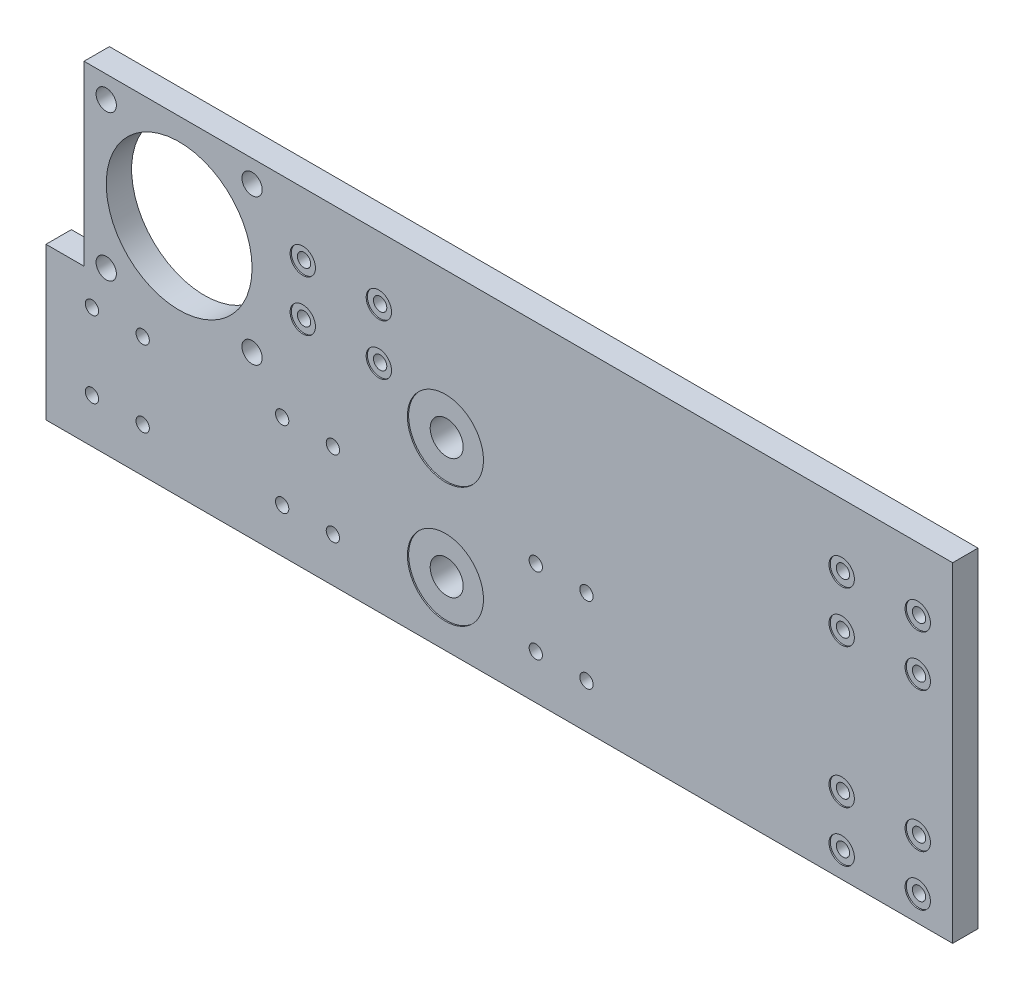
from build123d import *

# Parameters (mm, degrees)
SKETCH_1_R          = 11.5
SKETCH_1_R_2        = 1.6
SKETCH_1_R_3        = 1.05
SKETCH_1_R_4        = 2.6
EXTRUDE_1_DEPTH     = 4
SKETCH_2_R          = 2
SKETCH_2_R_2        = 6
CUT_EXTRUDE_1_DEPTH = 0.2
SKETCH_5_R          = 2
CUT_EXTRUDE_2_DEPTH = 2


with BuildPart() as part:
    # 草图1 → 凸台-拉伸1 (new body)
    with BuildSketch(Plane.XY):
        Polygon((0, 0), (135, 0), (135, -52), (0, -52), (-8, -52), (-8, -28), (-2, -28), (-2, 0), align=None)
        with Locations((13, -15)):
            Circle(SKETCH_1_R, mode=Mode.SUBTRACT)
        with Locations((1.5, -3.5)):
            Circle(SKETCH_1_R_2, mode=Mode.SUBTRACT)
        with Locations((24.5, -3.5)):
            Circle(SKETCH_1_R_2, mode=Mode.SUBTRACT)
        with Locations((1.5, -26.5)):
            Circle(SKETCH_1_R_2, mode=Mode.SUBTRACT)
        with Locations((24.5, -26.5)):
            Circle(SKETCH_1_R_2, mode=Mode.SUBTRACT)
        with Locations((32.5, -10)):
            Circle(SKETCH_1_R_3, mode=Mode.SUBTRACT)
        with Locations((44.5, -10)):
            Circle(SKETCH_1_R_3, mode=Mode.SUBTRACT)
        with Locations((32.5, -18)):
            Circle(SKETCH_1_R_3, mode=Mode.SUBTRACT)
        with Locations((44.5, -18)):
            Circle(SKETCH_1_R_3, mode=Mode.SUBTRACT)
        with Locations((117.5, -10)):
            Circle(SKETCH_1_R_3, mode=Mode.SUBTRACT)
        with Locations((129.5, -10)):
            Circle(SKETCH_1_R_3, mode=Mode.SUBTRACT)
        with Locations((117.5, -18)):
            Circle(SKETCH_1_R_3, mode=Mode.SUBTRACT)
        with Locations((129.5, -18)):
            Circle(SKETCH_1_R_3, mode=Mode.SUBTRACT)
        with Locations((-0.75, -33)):
            Circle(SKETCH_1_R_3, mode=Mode.SUBTRACT)
        with Locations((7.25, -33)):
            Circle(SKETCH_1_R_3, mode=Mode.SUBTRACT)
        with Locations((-0.75, -45)):
            Circle(SKETCH_1_R_3, mode=Mode.SUBTRACT)
        with Locations((7.25, -45)):
            Circle(SKETCH_1_R_3, mode=Mode.SUBTRACT)
        with Locations((29.25, -33)):
            Circle(SKETCH_1_R_3, mode=Mode.SUBTRACT)
        with Locations((37.25, -33)):
            Circle(SKETCH_1_R_3, mode=Mode.SUBTRACT)
        with Locations((37.25, -45)):
            Circle(SKETCH_1_R_3, mode=Mode.SUBTRACT)
        with Locations((29.25, -45)):
            Circle(SKETCH_1_R_3, mode=Mode.SUBTRACT)
        with Locations((117.5, -40)):
            Circle(SKETCH_1_R_3, mode=Mode.SUBTRACT)
        with Locations((129.5, -40)):
            Circle(SKETCH_1_R_3, mode=Mode.SUBTRACT)
        with Locations((117.5, -48)):
            Circle(SKETCH_1_R_3, mode=Mode.SUBTRACT)
        with Locations((129.5, -48)):
            Circle(SKETCH_1_R_3, mode=Mode.SUBTRACT)
        with Locations((55, -23)):
            Circle(SKETCH_1_R_4, mode=Mode.SUBTRACT)
        with Locations((55, -42)):
            Circle(SKETCH_1_R_4, mode=Mode.SUBTRACT)
        with Locations((77.25, -33)):
            Circle(SKETCH_1_R_3, mode=Mode.SUBTRACT)
        with Locations((77.25, -45)):
            Circle(SKETCH_1_R_3, mode=Mode.SUBTRACT)
        with Locations((69.25, -45)):
            Circle(SKETCH_1_R_3, mode=Mode.SUBTRACT)
        with Locations((69.25, -33)):
            Circle(SKETCH_1_R_3, mode=Mode.SUBTRACT)
    extrude(amount=EXTRUDE_1_DEPTH)

    # 草图2 → 切除-拉伸1 (cut)
    with BuildSketch(Plane.XY.offset(4)):
        with Locations((32.5, -10)):
            Circle(SKETCH_2_R)
        with Locations((44.5, -10)):
            Circle(SKETCH_2_R)
        with Locations((32.5, -18)):
            Circle(SKETCH_2_R)
        with Locations((44.5, -18)):
            Circle(SKETCH_2_R)
        with Locations((117.5, -10)):
            Circle(SKETCH_2_R)
        with Locations((129.5, -10)):
            Circle(SKETCH_2_R)
        with Locations((117.5, -18)):
            Circle(SKETCH_2_R)
        with Locations((129.5, -18)):
            Circle(SKETCH_2_R)
        with Locations((117.5, -40)):
            Circle(SKETCH_2_R)
        with Locations((129.5, -40)):
            Circle(SKETCH_2_R)
        with Locations((117.5, -48)):
            Circle(SKETCH_2_R)
        with Locations((55, -23)):
            Circle(SKETCH_2_R_2)
        with Locations((129.5, -48)):
            Circle(SKETCH_2_R)
        with Locations((55, -42)):
            Circle(SKETCH_2_R_2)
    extrude(amount=-CUT_EXTRUDE_1_DEPTH, mode=Mode.SUBTRACT)

    # 草图5 → 切除-拉伸2 (cut)
    with BuildSketch(Plane(origin=(0, 0, 0), x_dir=(-1, 0, 0), z_dir=(0, 0, -1))):
        with Locations((-37.25, -33)):
            Circle(SKETCH_5_R)
        with Locations((-29.25, -33)):
            Circle(SKETCH_5_R)
        with Locations((-37.25, -45)):
            Circle(SKETCH_5_R)
        with Locations((-29.25, -45)):
            Circle(SKETCH_5_R)
        with Locations((-7.25, -33)):
            Circle(SKETCH_5_R)
        with Locations((0.75, -33)):
            Circle(SKETCH_5_R)
        with Locations((-7.25, -45)):
            Circle(SKETCH_5_R)
        with Locations((0.75, -45)):
            Circle(SKETCH_5_R)
        with Locations((-69.25, -33)):
            Circle(SKETCH_5_R)
        with Locations((-69.25, -45)):
            Circle(SKETCH_5_R)
        with Locations((-77.25, -45)):
            Circle(SKETCH_5_R)
        with Locations((-77.25, -33)):
            Circle(SKETCH_5_R)
    extrude(amount=-CUT_EXTRUDE_2_DEPTH, mode=Mode.SUBTRACT)


solid = part.part
